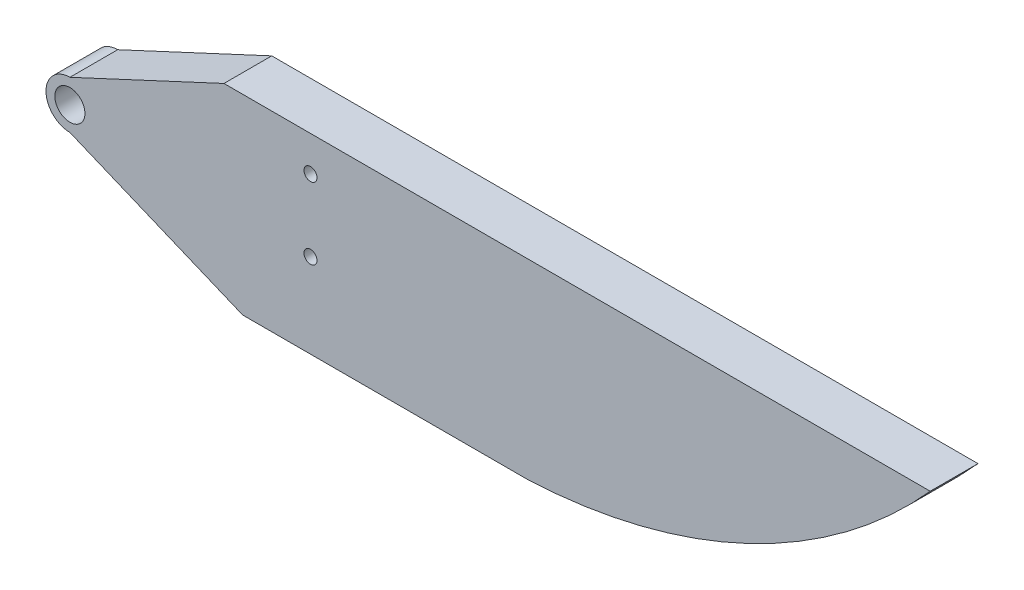
from build123d import *

# Parameters (mm, degrees)
SKETCH1_W                 = 241.3
SKETCH1_H                 = 50.8
BOSS_EXTRUDE1_DEPTH       = 12.7
SKETCH3_R                 = 4
CUT_EXTRUDE1_DEPTH        = 124.947055229
CUT_EXTRUDE2_DEPTH        = 124.947055229
TAP_DRILL_FOR_8_32_TAP1_D = 3.4544
SKETCH10_R                = 1.905
CUT_EXTRUDE3_DEPTH        = 5.08


with BuildPart() as part:
    # Sketch1 → Boss-Extrude1 (new body)
    with BuildSketch(Plane.XY):
        Rectangle(SKETCH1_W, SKETCH1_H)
    extrude(amount=BOSS_EXTRUDE1_DEPTH)

    # Sketch3 → Cut-Extrude1 (cut, through all)
    with BuildSketch(Plane.XY.offset(12.7)):
        with Locations((-107.95, 0)):
            Circle(SKETCH3_R)
    extrude(amount=-CUT_EXTRUDE1_DEPTH, mode=Mode.SUBTRACT)

    # Sketch5 → Cut-Extrude2 (cut, through all)
    with BuildSketch(Plane.XY.offset(12.7)):
        with BuildLine():
            Line((-62.046109456, -25.4), (-107.95, -6.35))
            ThreePointArc((-107.95, -6.35), (-114.3, 0), (-107.95, 6.35))
            Line((-107.95, 6.35), (-67.015128773, 25.4))
            Line((-67.015128773, 25.4), (-120.65, 25.4))
            Line((-120.65, 25.4), (-120.65, -25.4))
            Line((-120.65, -25.4), (-62.046109456, -25.4))
        make_face()
        with BuildLine():
            ThreePointArc((120.65, 25.4), (72.371753541, -10.785174559), (13.834903468, -25.4))
            Line((13.834903468, -25.4), (120.65, -25.4))
            Line((120.65, -25.4), (120.65, 25.4))
        make_face()
    extrude(amount=-CUT_EXTRUDE2_DEPTH, mode=Mode.SUBTRACT)

    # Tap Drill for #8-32 Tap1 (through all)
    with Locations(Plane(origin=(0, 0, 0), x_dir=(-1, 0, 0), z_dir=(0, 0, -1))):
        with Locations((44.020428639, 16.052306877), (44.020428639, -2.997693123)):
            Hole(TAP_DRILL_FOR_8_32_TAP1_D / 2)

    # Sketch10 → Cut-Extrude3 (cut)
    with BuildSketch(Plane.ZY.offset(114.3)):
        with Locations((6.089367744, 0)):
            Circle(SKETCH10_R)
    extrude(amount=-CUT_EXTRUDE3_DEPTH, mode=Mode.SUBTRACT)


solid = part.part
